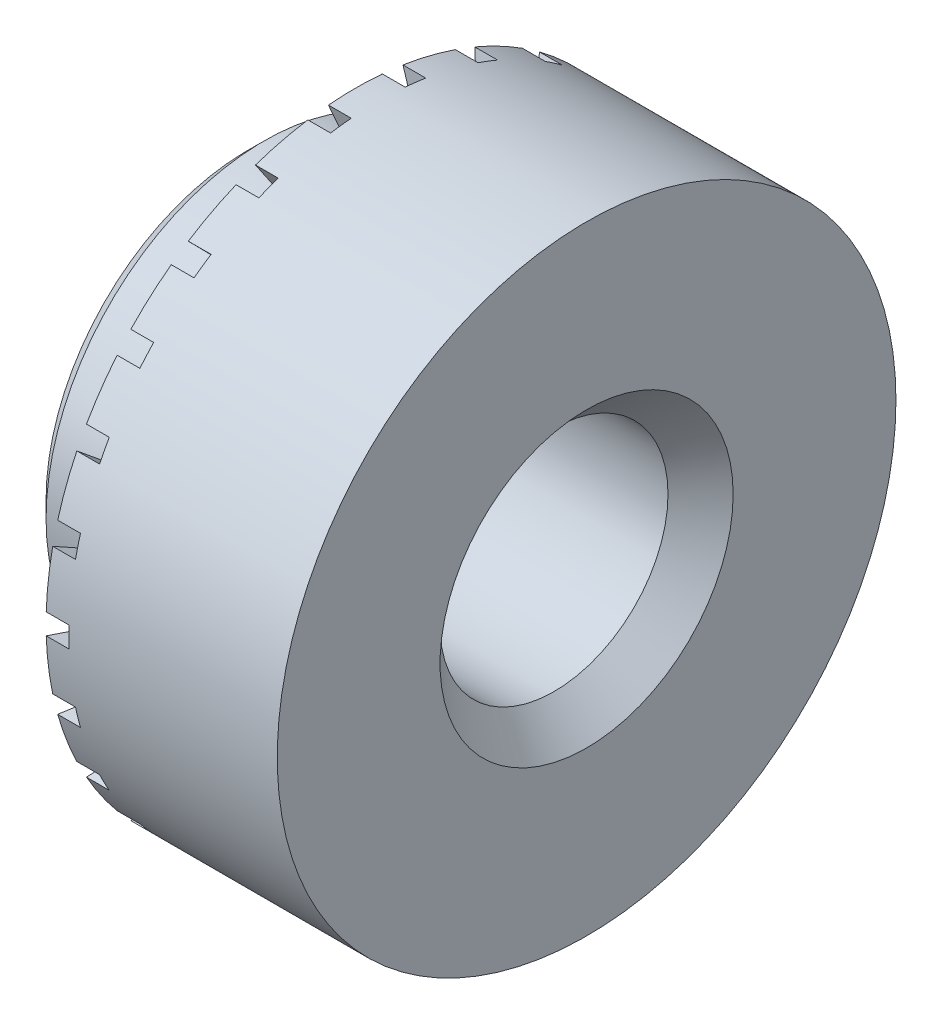
from build123d import *

# Parameters (mm, degrees)
SKETCH_1_R               = 4.75
EXTRUDE_1_DEPTH          = 3.2
SKETCH_2_R               = 3.35
EXTRUDE_2_DEPTH          = 2
SKETCH_3_R               = 1.75
CUT_EXTRUDE_1_DEPTH      = 9.494998529
CHAMFER_1_SIZE           = 0.5
CHAMFER_2_SIZE           = 0.25
REVOLVE_1_ANGLE          = 10
CUT_EXTRUDE_3_DEPTH      = 8.44076609
PATTERN_CIRCULAR_1_COUNT = 26


# Read off the part's stored shape, not the designer's step: Повернуть1
with BuildPart() as part:
    # Эскиз1 → Вытянуть1 (new body)
    with BuildSketch(Plane(origin=(0, 0, 0), x_dir=(0, 0, -1), z_dir=(1, 0, 0))):
        Circle(SKETCH_1_R)
    extrude(amount=EXTRUDE_1_DEPTH)

    # Эскиз2 → Вытянуть2 (add)
    with BuildSketch(Plane.ZY):
        with Locations(Location((0, 0, 0), (0, 0, 180))):
            Circle(SKETCH_2_R)
    extrude(amount=EXTRUDE_2_DEPTH)

    # Эскиз3 → Вырез-Вытянуть1 (cut, through all)
    with BuildSketch(Plane(origin=(3.2, 0, 0), x_dir=(0, 0, -1), z_dir=(1, 0, 0))):
        Circle(SKETCH_3_R)
    extrude(amount=-CUT_EXTRUDE_1_DEPTH, mode=Mode.SUBTRACT)

    # Фаска1
    chamfer_1_edges = [part.edges().sort_by_distance(p)[0] for p in [
        (-2, 0, 1.75),
        (3.2, 0, 1.75),
    ]]
    chamfer(chamfer_1_edges, length=CHAMFER_1_SIZE)

    # Фаска2
    chamfer_2_edges = [part.edges().sort_by_distance(p)[0] for p in [
        (-2, 0, 3.35),
    ]]
    chamfer(chamfer_2_edges, length=CHAMFER_2_SIZE)

    # Повернуть1 outline → Повернуть1 (revolve)
    with BuildSketch(Plane(origin=(0, 0, 0), x_dir=(0, 0.9961946980917455, -0.08715574274765835), z_dir=(0, -0.08715574274765835, -0.9961946980917455))):
        Polygon((4.75, 0), (3.35, 0), (4.75, -0.35), align=None)
    revolve(axis=Axis((0, 0, 0), (1, 0, 0)), revolution_arc=REVOLVE_1_ANGLE)

    # Эскиз5 → Вырез-Вытянуть3 (cut, through all)
    with BuildSketch(Plane.ZY):
        with BuildLine():
            Line((-0.291971738, 3.337252239), (-0.413989778, 4.731924816))
            ThreePointArc((-0.413989778, 4.731924816), (-0.416697281, 4.73168716), (-0.419404647, 4.731447954))
            Line((-0.419404647, 4.731447954), (-0.419404647, 3.323642541))
            ThreePointArc((-0.419404647, 3.323642541), (-0.35575328, 3.33105683), (-0.291971738, 3.337252239))
        make_face()
        with BuildLine():
            ThreePointArc((-0.291971738, 3.337252239), (-0.146124948, 3.346811542), (0, 3.35))
            Line((0, 3.35), (-0.413989778, 4.731924816))
            Line((-0.413989778, 4.731924816), (-0.291971738, 3.337252239))
        make_face()
        with BuildLine():
            Line((0.413989778, 4.731924816), (0, 3.35))
            ThreePointArc((0, 3.35), (0.146124948, 3.346811542), (0.291971738, 3.337252239))
            Line((0.291971738, 3.337252239), (0.413989778, 4.731924816))
        make_face()
        with BuildLine():
            ThreePointArc((0.419404647, 4.731447954), (0.416697281, 4.73168716), (0.413989778, 4.731924816))
            Line((0.413989778, 4.731924816), (0.291971738, 3.337252239))
            ThreePointArc((0.291971738, 3.337252239), (0.35575328, 3.33105683), (0.419404647, 3.323642541))
            Line((0.419404647, 3.323642541), (0.419404647, 4.731447954))
        make_face()
    extrude(amount=CUT_EXTRUDE_3_DEPTH, mode=Mode.SUBTRACT)

    # Круговой массив1: part ×26 about axis
    pattern_circular_1_axis = Axis((0, 0, 0), (1, 0, 0))


with BuildPart() as part_1:
    add(part.part)
    for i in range(1, PATTERN_CIRCULAR_1_COUNT):
        add(part.part.rotate(pattern_circular_1_axis, i * 360 / PATTERN_CIRCULAR_1_COUNT))


solid = part_1.part
